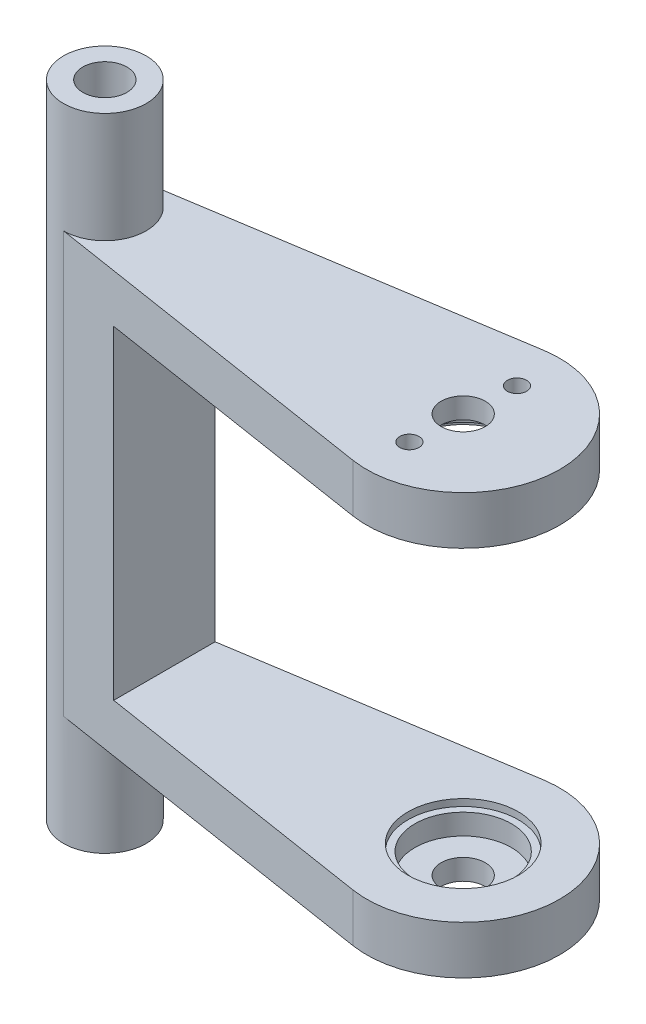
from build123d import *

# Parameters (mm, degrees)
SKETCH1_R               = 3.2
BOSS_EXTRUDE1_DEPTH     = 7
SKETCH2_R               = 3.2
BOSS_EXTRUDE2_DEPTH     = 47
BOSS_EXTRUDE3_OUTLINE_R = 3.2
BOSS_EXTRUDE3_DEPTH     = 7
CUT_EXTRUDE1_DEPTH      = 86.32877599
CUT_EXTRUDE1_DEPTH_BACK = 86.32877599
SKETCH5_R               = 3.2
SKETCH6_R               = 1.395
CUT_EXTRUDE2_DEPTH      = 2
SKETCH7_R               = 7
CUT_EXTRUDE3_DEPTH      = 4
SKETCH8_R               = 8
CUT_EXTRUDE4_DEPTH      = 1
CUT_EXTRUDE5_START      = -4
SKETCH9_R               = 7
CUT_EXTRUDE5_DEPTH      = 4
CUT_EXTRUDE6_START      = -1
SKETCH10_R              = 8
CUT_EXTRUDE6_DEPTH      = 1
SKETCH11_R              = 6
SKETCH11_R_2            = 3.2
BOSS_EXTRUDE4_DEPTH     = 16
BOSS_EXTRUDE5_START     = 16
SKETCH12_R              = 6
SKETCH12_R_2            = 3.2
BOSS_EXTRUDE5_DEPTH     = 16


# Read off the part's stored shape, not the designer's step: Boss-Extrude3
with BuildPart() as part:
    # Sketch1 → Boss-Extrude1 (new body)
    with BuildSketch(Plane(origin=(0, 0, 0), x_dir=(1, 0, 0), z_dir=(0, 1, 0))):
        with BuildLine():
            ThreePointArc((-52, 6), (-58, 0), (-52, -6))
            Line((-52, -6), (-2.173431493, -13.830264184))
            ThreePointArc((-2.173431493, -13.830264184), (14.000000424, -1.65e-07), (-2.173431166, 13.830264236))
            Line((-2.173431166, 13.830264236), (-52, 6))
        make_face()
        with Locations(Location((-52, 0, 0), (0, 0, 270))):
            Circle(SKETCH1_R, mode=Mode.SUBTRACT)
    extrude(amount=BOSS_EXTRUDE1_DEPTH)

    # Sketch2 → Boss-Extrude2 (add)
    # profile 1 of 2: a face of its own
    with BuildSketch(Plane(origin=(0, 7, 0), x_dir=(1, 0, 0), z_dir=(0, 1, 0))):
        with BuildLine():
            ThreePointArc((-46, 0), (-47.757359313, 4.242640687), (-52, 6))
            ThreePointArc((-52, 6), (-58, 0), (-52, -6))
            ThreePointArc((-52, -6), (-47.757359313, -4.242640687), (-46, 0))
        make_face()
        with Locations(Location((-52, 0, 0), (0, 0, 270))):
            Circle(SKETCH2_R, mode=Mode.SUBTRACT)
    # profile 2 of 2: a face of its own
    with BuildSketch(Plane(origin=(0, 7, 0), x_dir=(1, 0, 0), z_dir=(0, 1, 0))):
        with BuildLine():
            Line((-43.357698304, -7.358140997), (-43.357698304, 7.358140997))
            Line((-43.357698304, 7.358140997), (-52, 6))
            ThreePointArc((-52, 6), (-47.757359313, 4.242640687), (-46, 0))
            ThreePointArc((-46, 0), (-47.757359313, -4.242640687), (-52, -6))
            Line((-52, -6), (-43.357698304, -7.358140997))
        make_face()
    extrude(amount=BOSS_EXTRUDE2_DEPTH)

    # Boss-Extrude3 outline → Boss-Extrude3 (add)
    with BuildSketch(Plane(origin=(0, 54, 0), x_dir=(1, 0, 0), z_dir=(0, 1, 0))):
        with BuildLine():
            ThreePointArc((-2.17343128, -13.830264218), (14.000000424, -1.07e-07), (-2.173431068, 13.830264251))
            Line((-2.173431068, 13.830264251), (-52, 6))
            ThreePointArc((-52, 6), (-58, 0), (-52, -6))
            Line((-52, -6), (-2.17343128, -13.830264218))
        make_face()
        with Locations((-52, 0)):
            Circle(BOSS_EXTRUDE3_OUTLINE_R, mode=Mode.SUBTRACT)
    extrude(amount=BOSS_EXTRUDE3_DEPTH)

    # Sketch5 → Cut-Extrude1 (cut, two sides: drawn at the far end of the back side and taken through both)
    with BuildSketch(Plane(origin=(0, 61, 0), x_dir=(1, 0, 0), z_dir=(0, 1, 0)).offset(-CUT_EXTRUDE1_DEPTH_BACK)):
        with Locations(Location((0, 0, 0), (0, 0, 270))):
            Circle(SKETCH5_R)
    extrude(amount=CUT_EXTRUDE1_DEPTH + CUT_EXTRUDE1_DEPTH_BACK, mode=Mode.SUBTRACT)

    # Sketch6 → Cut-Extrude2 (cut)
    with BuildSketch(Plane(origin=(0, 61, 0), x_dir=(1, 0, 0), z_dir=(0, 1, 0))):
        with Locations(Location((-0.370638007, -7.432964974, 0), (0, 0, 270))):
            Circle(SKETCH6_R)
        with Locations(Location((0.370638007, 7.432964974, 0), (0, 0, 270))):
            Circle(SKETCH6_R)
    extrude(amount=-CUT_EXTRUDE2_DEPTH, mode=Mode.SUBTRACT)

    # Sketch7 → Cut-Extrude3 (cut)
    with BuildSketch(Plane.XZ.offset(-54)):
        with Locations(Location((0, 0, 0), (0, 0, 270))):
            Circle(SKETCH7_R)
    extrude(amount=-CUT_EXTRUDE3_DEPTH, mode=Mode.SUBTRACT)

    # Sketch8 → Cut-Extrude4 (cut)
    with BuildSketch(Plane.XZ.offset(-54)):
        with Locations(Location((0, 0, 0), (0, 0, 270))):
            Circle(SKETCH8_R)
    extrude(amount=-CUT_EXTRUDE4_DEPTH, mode=Mode.SUBTRACT)

    # Sketch9 → Cut-Extrude5 (cut)
    with BuildSketch(Plane(origin=(0, 7, 0), x_dir=(1, 0, 0), z_dir=(0, 1, 0)).offset(CUT_EXTRUDE5_START)):
        with Locations(Location((0, 0, 0), (0, 0, 90))):
            Circle(SKETCH9_R)
    extrude(amount=CUT_EXTRUDE5_DEPTH, mode=Mode.SUBTRACT)

    # Sketch10 → Cut-Extrude6 (cut)
    with BuildSketch(Plane(origin=(0, 7, 0), x_dir=(1, 0, 0), z_dir=(0, 1, 0)).offset(CUT_EXTRUDE6_START)):
        with Locations(Location((0, 0, 0), (0, 0, 90))):
            Circle(SKETCH10_R)
    extrude(amount=CUT_EXTRUDE6_DEPTH, mode=Mode.SUBTRACT)

    # Sketch11 → Boss-Extrude4 (add)
    with BuildSketch(Plane(origin=(0, 61, 0), x_dir=(1, 0, 0), z_dir=(0, 1, 0))):
        with Locations(Location((-52, 0, 0), (0, 0, 270))):
            Circle(SKETCH11_R)
        with Locations(Location((-52, 0, 0), (0, 0, 270))):
            Circle(SKETCH11_R_2, mode=Mode.SUBTRACT)
    extrude(amount=BOSS_EXTRUDE4_DEPTH)

    # Sketch12 → Boss-Extrude5 (add)
    with BuildSketch(Plane.XZ.offset(BOSS_EXTRUDE5_START)):
        with Locations(Location((-52, 0, 0), (0, 0, 270))):
            Circle(SKETCH12_R)
        with Locations(Location((-52, 0, 0), (0, 0, 270))):
            Circle(SKETCH12_R_2, mode=Mode.SUBTRACT)
    extrude(amount=-BOSS_EXTRUDE5_DEPTH)


solid = part.part
